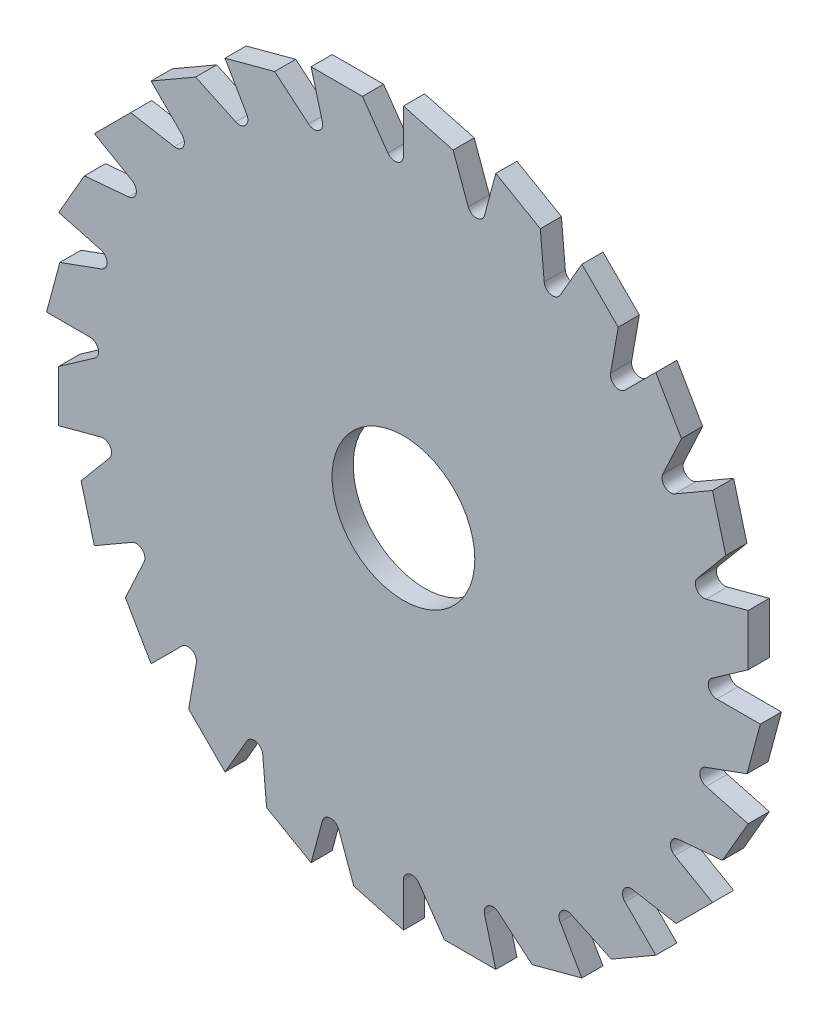
from build123d import *

# Parameters (mm, degrees)
SKETCH1_R           = 6.35
BOSS_EXTRUDE1_DEPTH = 1.8796


with BuildPart() as part:
    # Sketch1 → Boss-Extrude1 (new body)
    with BuildSketch(Plane.XY):
        with BuildLine():
            Line((4.416212878, 30.566679326), (0, 31.75))
            Line((0, 31.75), (0, 27.878579979))
            ThreePointArc((0, 27.878579979), (-0.532862181, 27.151847662), (-1.386193858, 27.441514734))
            Line((-1.386193858, 27.441514734), (-3.645504682, 30.668144985))
            Line((-3.645504682, 30.668144985), (-8.217504682, 30.668144985))
            Line((-8.217504682, 30.668144985), (-7.215507449, 26.928640402))
            ThreePointArc((-7.215507449, 26.928640402), (-7.542120627, 26.088756008), (-8.441347087, 26.147694424))
            Line((-8.441347087, 26.147694424), (-11.458787122, 28.679627244))
            Line((-11.458787122, 28.679627244), (-15.875, 27.49630657))
            Line((-15.875, 27.49630657), (-13.939289989, 24.143558483))
            ThreePointArc((-13.939289989, 24.143558483), (-14.037396016, 23.247758745), (-14.921236463, 23.071951949))
            Line((-14.921236463, 23.071951949), (-18.491172157, 24.736640303))
            Line((-18.491172157, 24.736640303), (-22.450640303, 22.450640303))
            Line((-22.450640303, 22.450640303), (-19.713132953, 19.713132953))
            ThreePointArc((-19.713132953, 19.713132953), (-19.576046065, 18.822465142), (-20.384268232, 18.423894078))
            Line((-20.384268232, 18.423894078), (-24.263414367, 19.107892204))
            Line((-24.263414367, 19.107892204), (-27.49630657, 15.875))
            Line((-27.49630657, 15.875), (-24.143558483, 13.939289989))
            ThreePointArc((-24.143558483, 13.939289989), (-23.780620926, 13.114451646), (-24.458145807, 12.520278272))
            Line((-24.458145807, 12.520278272), (-28.382144985, 12.176972828))
            Line((-28.382144985, 12.176972828), (-30.668144985, 8.217504682))
            Line((-30.668144985, 8.217504682), (-26.928640402, 7.215507449))
            ThreePointArc((-26.928640402, 7.215507449), (-26.364585769, 6.512709942), (-26.865241165, 5.763426192))
            Line((-26.865241165, 5.763426192), (-30.566679326, 4.416212878))
            Line((-30.566679326, 4.416212878), (-31.75, 0))
            Line((-31.75, 0), (-27.878579979, 0))
            ThreePointArc((-27.878579979, 0), (-27.151847662, -0.532862181), (-27.441514734, -1.386193858))
            Line((-27.441514734, -1.386193858), (-30.668144985, -3.645504682))
            Line((-30.668144985, -3.645504682), (-30.668144985, -8.217504682))
            Line((-30.668144985, -8.217504682), (-26.928640402, -7.215507449))
            ThreePointArc((-26.928640402, -7.215507449), (-26.088756008, -7.542120627), (-26.147694424, -8.441347087))
            Line((-26.147694424, -8.441347087), (-28.679627244, -11.458787122))
            Line((-28.679627244, -11.458787122), (-27.49630657, -15.875))
            Line((-27.49630657, -15.875), (-24.143558483, -13.939289989))
            ThreePointArc((-24.143558483, -13.939289989), (-23.247758745, -14.037396016), (-23.071951949, -14.921236463))
            Line((-23.071951949, -14.921236463), (-24.736640303, -18.491172157))
            Line((-24.736640303, -18.491172157), (-22.450640303, -22.450640303))
            Line((-22.450640303, -22.450640303), (-19.713132953, -19.713132953))
            ThreePointArc((-19.713132953, -19.713132953), (-18.822465142, -19.576046065), (-18.423894078, -20.384268232))
            Line((-18.423894078, -20.384268232), (-19.107892204, -24.263414367))
            Line((-19.107892204, -24.263414367), (-15.875, -27.49630657))
            Line((-15.875, -27.49630657), (-13.939289989, -24.143558483))
            ThreePointArc((-13.939289989, -24.143558483), (-13.114451646, -23.780620926), (-12.520278272, -24.458145807))
            Line((-12.520278272, -24.458145807), (-12.176972828, -28.382144985))
            Line((-12.176972828, -28.382144985), (-8.217504682, -30.668144985))
            Line((-8.217504682, -30.668144985), (-7.215507449, -26.928640402))
            ThreePointArc((-7.215507449, -26.928640402), (-6.512709942, -26.364585769), (-5.763426192, -26.865241165))
            Line((-5.763426192, -26.865241165), (-4.416212878, -30.566679326))
            Line((-4.416212878, -30.566679326), (0, -31.75))
            Line((0, -31.75), (0, -27.878579979))
            ThreePointArc((0, -27.878579979), (0.532862181, -27.151847662), (1.386193858, -27.441514734))
            Line((1.386193858, -27.441514734), (3.645504682, -30.668144985))
            Line((3.645504682, -30.668144985), (8.217504682, -30.668144985))
            Line((8.217504682, -30.668144985), (7.215507449, -26.928640402))
            ThreePointArc((7.215507449, -26.928640402), (7.542120627, -26.088756008), (8.441347087, -26.147694424))
            Line((8.441347087, -26.147694424), (11.458787122, -28.679627244))
            Line((11.458787122, -28.679627244), (15.875, -27.49630657))
            Line((15.875, -27.49630657), (13.939289989, -24.143558483))
            ThreePointArc((13.939289989, -24.143558483), (14.037396016, -23.247758745), (14.921236463, -23.071951949))
            Line((14.921236463, -23.071951949), (18.491172157, -24.736640303))
            Line((18.491172157, -24.736640303), (22.450640303, -22.450640303))
            Line((22.450640303, -22.450640303), (19.713132953, -19.713132953))
            ThreePointArc((19.713132953, -19.713132953), (19.576046065, -18.822465142), (20.384268232, -18.423894078))
            Line((20.384268232, -18.423894078), (24.263414367, -19.107892204))
            Line((24.263414367, -19.107892204), (27.49630657, -15.875))
            Line((27.49630657, -15.875), (24.143558483, -13.939289989))
            ThreePointArc((24.143558483, -13.939289989), (23.780620926, -13.114451646), (24.458145807, -12.520278272))
            Line((24.458145807, -12.520278272), (28.382144985, -12.176972828))
            Line((28.382144985, -12.176972828), (30.668144985, -8.217504682))
            Line((30.668144985, -8.217504682), (26.928640402, -7.215507449))
            ThreePointArc((26.928640402, -7.215507449), (26.364585769, -6.512709942), (26.865241165, -5.763426192))
            Line((26.865241165, -5.763426192), (30.566679326, -4.416212878))
            Line((30.566679326, -4.416212878), (31.75, 0))
            Line((31.75, 0), (27.878579979, 0))
            ThreePointArc((27.878579979, 0), (27.151847662, 0.532862181), (27.441514734, 1.386193858))
            Line((27.441514734, 1.386193858), (30.668144985, 3.645504682))
            Line((30.668144985, 3.645504682), (30.668144985, 8.217504682))
            Line((30.668144985, 8.217504682), (26.928640402, 7.215507449))
            ThreePointArc((26.928640402, 7.215507449), (26.088756008, 7.542120627), (26.147694424, 8.441347087))
            Line((26.147694424, 8.441347087), (28.679627244, 11.458787122))
            Line((28.679627244, 11.458787122), (27.49630657, 15.875))
            Line((27.49630657, 15.875), (24.143558483, 13.939289989))
            ThreePointArc((24.143558483, 13.939289989), (23.247758745, 14.037396016), (23.071951949, 14.921236463))
            Line((23.071951949, 14.921236463), (24.736640303, 18.491172157))
            Line((24.736640303, 18.491172157), (22.450640303, 22.450640303))
            Line((22.450640303, 22.450640303), (19.713132953, 19.713132953))
            ThreePointArc((19.713132953, 19.713132953), (18.822465142, 19.576046065), (18.423894078, 20.384268232))
            Line((18.423894078, 20.384268232), (19.107892204, 24.263414367))
            Line((19.107892204, 24.263414367), (15.875, 27.49630657))
            Line((15.875, 27.49630657), (13.939289989, 24.143558483))
            ThreePointArc((13.939289989, 24.143558483), (13.114451646, 23.780620926), (12.520278272, 24.458145807))
            Line((12.520278272, 24.458145807), (12.176972828, 28.382144985))
            Line((12.176972828, 28.382144985), (8.217504682, 30.668144985))
            Line((8.217504682, 30.668144985), (7.215507449, 26.928640402))
            ThreePointArc((7.215507449, 26.928640402), (6.512709942, 26.364585769), (5.763426192, 26.865241165))
            Line((5.763426192, 26.865241165), (4.416212878, 30.566679326))
        make_face()
        Circle(SKETCH1_R, mode=Mode.SUBTRACT)
    extrude(amount=BOSS_EXTRUDE1_DEPTH)


solid = part.part
